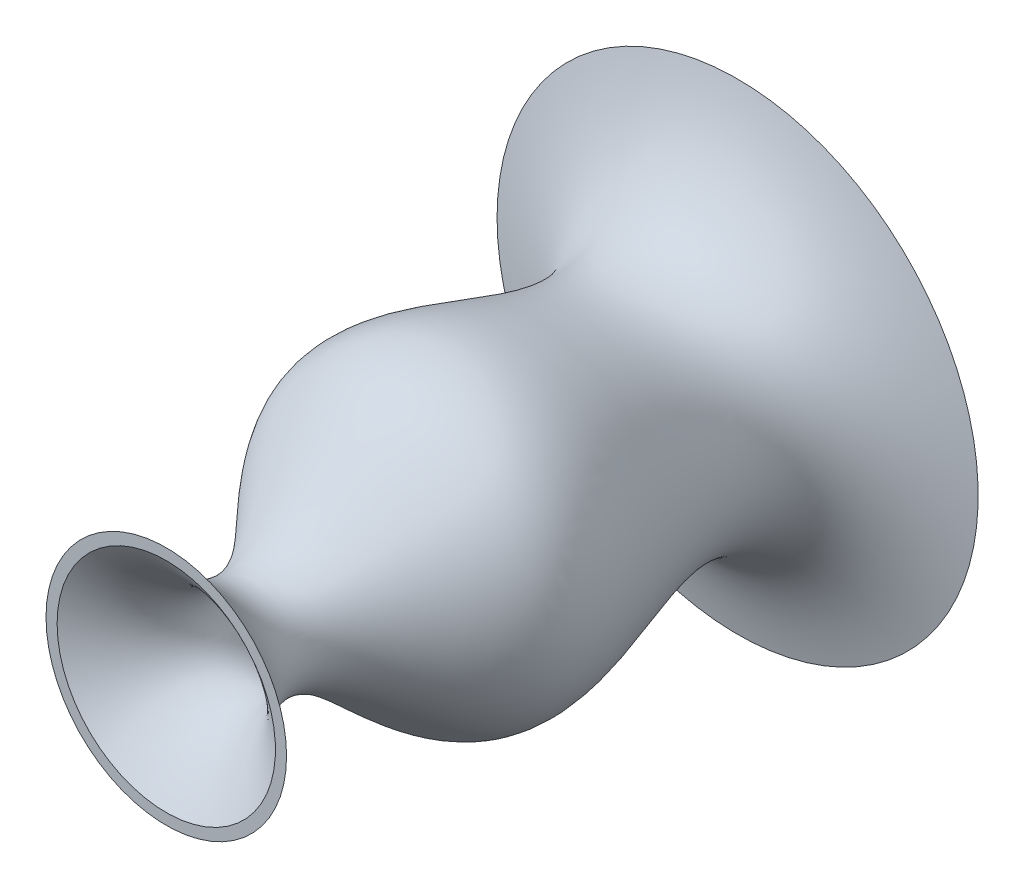
from build123d import *

# Parameters (mm, degrees)
SHELL1_T = -2.54


with BuildPart() as part:
    # Sketch1 → Revolve1 (revolve)
    with BuildSketch(Plane.YZ):
        with BuildLine():
            Line((0, 241.3), (0, 0))
            Line((0, 0), (101.6, 0))
            add(Edge.make_bspline(
                [(50.8, 241.3), (-17.17231624, 198.708109589), (140.989603279, 144.448815338), (-0.614962808, 24.649637459), (101.6, 0)],
                knots=[0, 0, 0, 0, 0.431374722, 1, 1, 1, 1], degree=3))
            Line((50.8, 241.3), (0, 241.3))
        make_face()
    revolve(axis=Axis((0, 0, 0), (0, 0, 1)))

    # Shell1
    shell1_openings = [part.faces().sort_by_distance(p)[0] for p in [
        (0, 0, 241.3),
    ]]
    offset(amount=SHELL1_T, openings=shell1_openings, kind=Kind.INTERSECTION)


solid = part.part
